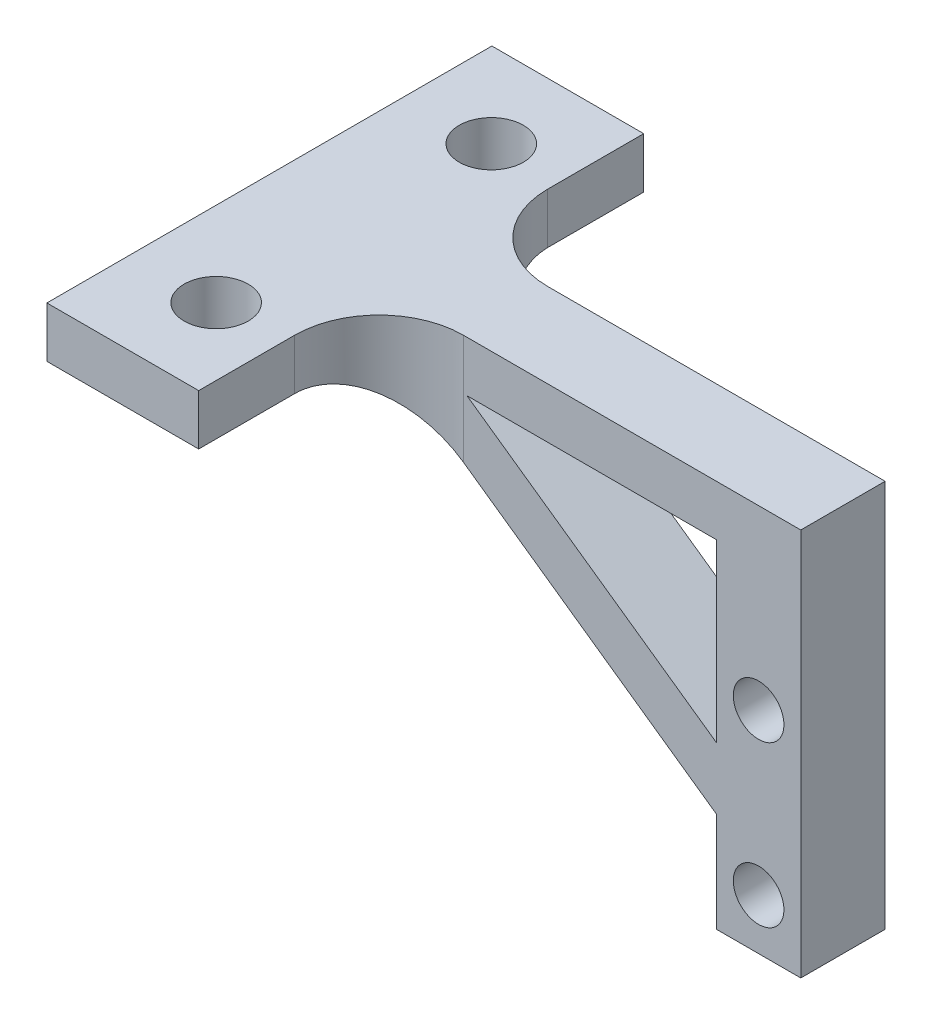
from build123d import *

# Parameters (mm, degrees)
SKETCH1_W                       = 9
SKETCH1_H                       = 26.38
SKETCH1_R                       = 1.9
BODY_MOUNT_DEPTH                = 3
SKETCH2_W                       = 5
SKETCH2_H                       = 3
BOSS_EXTRUDE2_DEPTH             = 25
SKETCH3_W                       = 5
SKETCH3_H                       = 5
BOSS_EXTRUDE3_DEPTH             = 20
SKETCH4_R                       = 1.5
CUT_EXTRUDE1_DEPTH              = 20
BOSS_EXTRUDE4_REACH             = 39.616
BOSS_EXTRUDE4_DIRECTION_2_REACH = 39.616
FILLET2_R                       = 5


with BuildPart() as part:
    # Sketch1 → body mount (new body)
    with BuildSketch(Plane(origin=(0, 0, 0), x_dir=(1, 0, 0), z_dir=(0, 1, 0))):
        with Locations((-0.5, 8.155)):
            Rectangle(SKETCH1_W, SKETCH1_H)
        with Locations(Location((0, 0, 0), (0, 0, 270))):
            Circle(SKETCH1_R, mode=Mode.SUBTRACT)
        with Locations(Location((0, 16.31, 0), (0, 0, 270))):
            Circle(SKETCH1_R, mode=Mode.SUBTRACT)
    extrude(amount=BODY_MOUNT_DEPTH)

    # Sketch2 → Boss-Extrude2 (add)
    with BuildSketch(Plane(origin=(4, 0, 0), x_dir=(0, 0, -1), z_dir=(1, 0, 0))):
        with Locations((8.155, 1.5)):
            Rectangle(SKETCH2_W, SKETCH2_H)
    extrude(amount=BOSS_EXTRUDE2_DEPTH)

    # Sketch3 → Boss-Extrude3 (add)
    with BuildSketch(Plane.XZ):
        with Locations((26.5, -8.155)):
            Rectangle(SKETCH3_W, SKETCH3_H)
    extrude(amount=BOSS_EXTRUDE3_DEPTH)

    # Sketch4 → Cut-Extrude1 (cut)
    with BuildSketch(Plane(origin=(0, 0, -10.655), x_dir=(-1, 0, 0), z_dir=(0, 0, -1))):
        with Locations((-26.5, -17)):
            Circle(SKETCH4_R)
        with Locations((-26.5, -7.5)):
            Circle(SKETCH4_R)
    extrude(amount=-CUT_EXTRUDE1_DEPTH, mode=Mode.SUBTRACT)

    # Boss-Extrude4: up to this face of the body (flat: up to its plane)
    boss_extrude4_end = Plane(part.part.faces().sort_by_distance((16.5, 2.660294245, -10.655))[0])
    # Sketch5 → Boss-Extrude4 (add, up to the picked face)
    with BuildSketch(Plane(origin=(0, 0, -8.155), x_dir=(-1, 0, 0), z_dir=(0, 0, -1)), mode=Mode.PRIVATE) as boss_extrude4_sk1:
        Polygon((-24, -10.415369352), (-9.210305315, 0), (-4, 0), (-24, -14.084630648), align=None)
    boss_extrude4_tool1 = split(extrude(boss_extrude4_sk1.sketch, amount=BOSS_EXTRUDE4_REACH, mode=Mode.PRIVATE), bisect_by=boss_extrude4_end, keep=Keep.BOTH, mode=Mode.PRIVATE)
    add(boss_extrude4_tool1.solids().sort_by(Axis((15.237549, -6.170794, -8.155), (0, 0, -1)))[0])

    # Boss-Extrude4 direction 2: up to this face of the body (flat: up to its plane)
    boss_extrude4_direction_2_end = Plane(part.part.faces().sort_by_distance((14, 0.339705755, -5.655))[0])
    # Sketch5 → Boss-Extrude4 direction 2 (add, up to the picked face)
    with BuildSketch(Plane(origin=(0, 0, -8.155), x_dir=(-1, 0, 0), z_dir=(0, 0, -1)), mode=Mode.PRIVATE) as boss_extrude4_direction_2_sk1:
        Polygon((-24, -10.415369352), (-9.210305315, 0), (-4, 0), (-24, -14.084630648), align=None)
    boss_extrude4_direction_2_tool1 = split(extrude(boss_extrude4_direction_2_sk1.sketch, amount=-BOSS_EXTRUDE4_DIRECTION_2_REACH, mode=Mode.PRIVATE), bisect_by=boss_extrude4_direction_2_end, keep=Keep.BOTH, mode=Mode.PRIVATE)
    add(boss_extrude4_direction_2_tool1.solids().sort_by(Axis((15.237549, -6.170794, -8.155), (0, 0, 1)))[0])

    # Fillet2
    # the kernel refuses this fillet: 5 mm, written as the material it adds along each edge
    with BuildSketch(Plane(origin=(4, 3, -10.655), x_dir=(0, 0, -1), z_dir=(0, -1, 0))) as fillet2_piece_1_section:
        with BuildLine():
            CenterArc((FILLET2_R, FILLET2_R), FILLET2_R, 180, 90)
            Line((0, FILLET2_R), (0, 0))
            Line((0, 0), (FILLET2_R, 0))
        make_face()
    fillet2_piece_1 = extrude(amount=3, mode=Mode.PRIVATE)
    fillet2_piece_1 = split(fillet2_piece_1, bisect_by=Plane(origin=(4.050655402, -0.035673131, -11.785736825), z_dir=(0.5757819971310116, 0.8176032606220598, 0)), keep=Keep.TOP, mode=Mode.PRIVATE)
    add(fillet2_piece_1)
    with BuildSketch(Plane(origin=(4, 3, -10.655), x_dir=(0, 0, -1), z_dir=(0, -1, 0))) as fillet2_piece_2_section:
        with BuildLine():
            CenterArc((FILLET2_R, FILLET2_R), FILLET2_R, 180, 90)
            Line((0, FILLET2_R), (0, 0))
            Line((0, 0), (FILLET2_R, 0))
        make_face()
    fillet2_piece_2 = extrude(amount=15.5, mode=Mode.PRIVATE)
    fillet2_piece_2 = split(fillet2_piece_2, bisect_by=Plane(origin=(6.150590259, 0, -11.187362576), z_dir=(0, -1, 0)), keep=Keep.TOP, mode=Mode.PRIVATE)
    fillet2_piece_2 = split(fillet2_piece_2, bisect_by=Plane(origin=(5.79410314, -1.263464003, -11.187362576), z_dir=(0.5757819971310116, 0.8176032606220598, 0)), keep=Keep.TOP, mode=Mode.PRIVATE)
    add(fillet2_piece_2)
    with BuildSketch(Plane(origin=(4, -12.5, -5.655), x_dir=(1, 0, 0), z_dir=(0, 1, 0))) as fillet2_piece_3_section:
        with BuildLine():
            CenterArc((FILLET2_R, -FILLET2_R), FILLET2_R, 90, 90)
            Line((0, -FILLET2_R), (0, 0))
            Line((0, 0), (FILLET2_R, 0))
        make_face()
    fillet2_piece_3 = extrude(amount=15.5, mode=Mode.PRIVATE)
    fillet2_piece_3 = split(fillet2_piece_3, bisect_by=Plane(origin=(5.79410314, -1.263464003, -5.122637424), z_dir=(0.5757819971310116, 0.8176032606220598, 0)), keep=Keep.TOP, mode=Mode.PRIVATE)
    fillet2_piece_3 = split(fillet2_piece_3, bisect_by=Plane(origin=(6.150590259, 0, -5.122637424), z_dir=(0, -1, 0)), keep=Keep.TOP, mode=Mode.PRIVATE)
    add(fillet2_piece_3)
    with BuildSketch(Plane(origin=(4, 0, -5.655), x_dir=(1, 0, 0), z_dir=(0, 1, 0))) as fillet2_piece_4_section:
        with BuildLine():
            CenterArc((FILLET2_R, -FILLET2_R), FILLET2_R, 90, 90)
            Line((0, -FILLET2_R), (0, 0))
            Line((0, 0), (FILLET2_R, 0))
        make_face()
    fillet2_piece_4 = extrude(amount=3, mode=Mode.PRIVATE)
    fillet2_piece_4 = split(fillet2_piece_4, bisect_by=Plane(origin=(4.050655402, -0.035673131, -4.524263175), z_dir=(0.5757819971310116, 0.8176032606220598, 0)), keep=Keep.TOP, mode=Mode.PRIVATE)
    add(fillet2_piece_4)


solid = part.part
